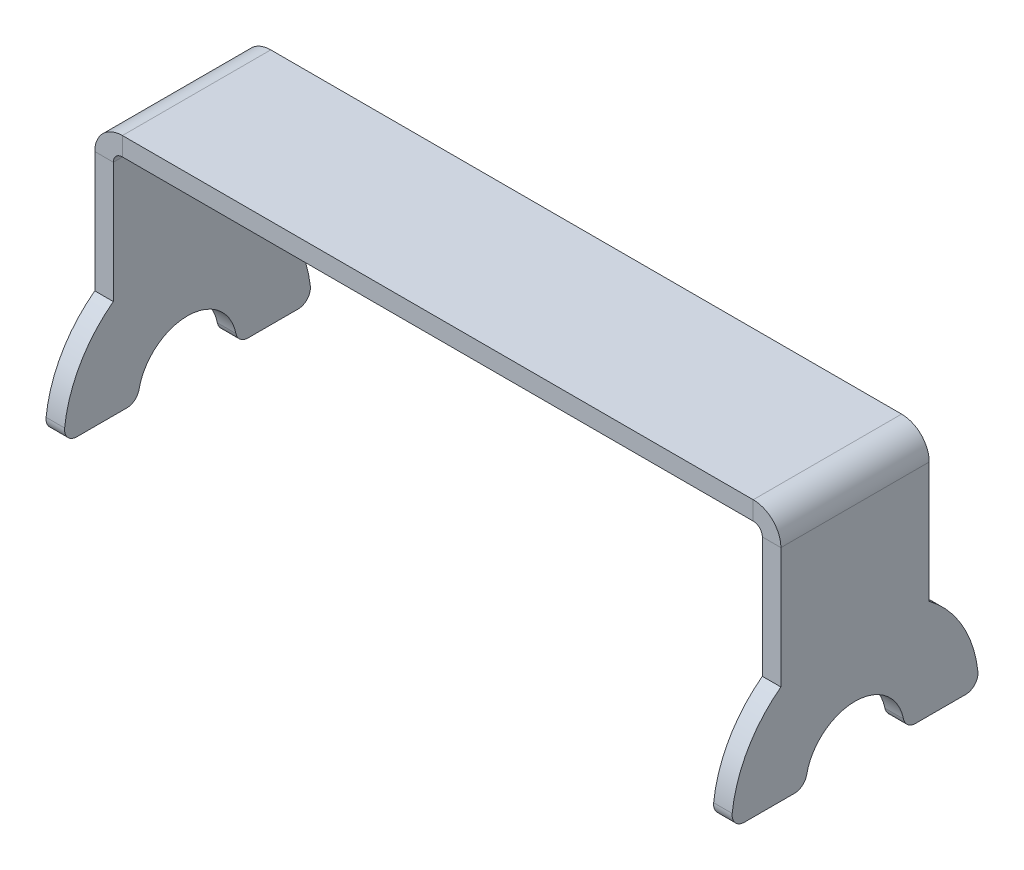
from build123d import *

# Parameters (mm, degrees)
CROQUIS2_W                         = 55.5
CROQUIS2_H                         = 12
BRIDA_BASE1_DEPTH                  = 1.5
BRIDA_DE_ARISTA1_STRIP_W           = 7.4732
BRIDA_DE_ARISTA1_STRIP_H           = 1.5
BRIDA_DE_ARISTA1_STRIP_CUT_DEPTH   = 12
BRIDA_DE_ARISTA1_STRIP_2_W         = 7.4732
BRIDA_DE_ARISTA1_STRIP_2_H         = 1.5
BRIDA_DE_ARISTA1_STRIP_CUT_2_DEPTH = 12
BRIDA_DE_ARISTA1_DEPTH             = 12
BRIDA_DE_ARISTA1_BEND_DEPTH        = 12
SALIENTE_EXTRUIR1_DEPTH            = 1.5
SALIENTE_EXTRUIR2_START            = -1.5
SALIENTE_EXTRUIR2_DEPTH            = 1.5
CORTAR_EXTRUIR2_REACH              = 61.835
CROQUIS17_R                        = 4
REDONDEO1_R                        = 1
REDONDEO2_R                        = 1


# Sheet-metal steps are written as plain solids
with BuildPart() as part:
    # Croquis2 → Brida base1 (new body)
    with BuildSketch(Plane(origin=(0, 0, 0), x_dir=(1, 0, 0), z_dir=(0, 1, 0))):
        Rectangle(CROQUIS2_W, CROQUIS2_H)
    extrude(amount=-BRIDA_BASE1_DEPTH)

    # Brida de arista1 strip (across the edge) → Brida de arista1 strip cut (cut)
    with BuildSketch(Plane(origin=(-27.75, -1.5, 6), x_dir=(1, 0, 0), z_dir=(0, 0, -1))):
        with Locations((-1.5, -0.75)):
            Rectangle(BRIDA_DE_ARISTA1_STRIP_W, BRIDA_DE_ARISTA1_STRIP_H)
    extrude(amount=BRIDA_DE_ARISTA1_STRIP_CUT_DEPTH, mode=Mode.SUBTRACT)

    # Brida de arista1 strip 2 (across the edge) → Brida de arista1 strip cut 2 (cut)
    with BuildSketch(Plane(origin=(27.75, -1.5, -6), x_dir=(-1, 0, 0), z_dir=(0, 0, 1))):
        with Locations((-1.5, -0.75)):
            Rectangle(BRIDA_DE_ARISTA1_STRIP_2_W, BRIDA_DE_ARISTA1_STRIP_2_H)
    extrude(amount=BRIDA_DE_ARISTA1_STRIP_CUT_2_DEPTH, mode=Mode.SUBTRACT)

    # Brida de arista1 section (across the edge) → Brida de arista1 (add)
    with BuildSketch(Plane(origin=(-27.75, -1.5, 6), x_dir=(1, 0, 0), z_dir=(0, 0, -1))):
        with BuildLine():
            Line((0, 0.7366), (0, 18.5))
            Line((0, 18.5), (1.5, 18.5))
            Line((1.5, 18.5), (1.5, 0.7366))
            ThreePointArc((1.5, 0.7366), (1.715745145, 0.215745145), (2.2366, 0))
            Line((2.2366, 0), (2.2366, -1.5))
            ThreePointArc((2.2366, -1.5), (0.655084973, -0.844915027), (0, 0.7366))
        make_face()
    extrude(amount=BRIDA_DE_ARISTA1_DEPTH)

    # Brida de arista1 section 2 (across the edge) → Brida de arista1 bend (add)
    with BuildSketch(Plane(origin=(27.75, -1.5, -6), x_dir=(-1, 0, 0), z_dir=(0, 0, 1))):
        with BuildLine():
            Line((0, 0.7366), (0, 18.5))
            Line((0, 18.5), (1.5, 18.5))
            Line((1.5, 18.5), (1.5, 0.7366))
            ThreePointArc((1.5, 0.7366), (1.715745145, 0.215745145), (2.2366, 0))
            Line((2.2366, 0), (2.2366, -1.5))
            ThreePointArc((2.2366, -1.5), (0.655084973, -0.844915027), (0, 0.7366))
        make_face()
    extrude(amount=BRIDA_DE_ARISTA1_BEND_DEPTH)

    # Croquis13 → Saliente-Extruir1 (add)
    with BuildSketch(Plane.ZY.offset(27.75)):
        with BuildLine():
            Line((-6, -20), (-10, -20))
            ThreePointArc((-10, -20), (-8.94427191, -15.527864045), (-6, -12))
            Line((-6, -12), (-6, -20))
        make_face()
        with BuildLine():
            Line((6, -20), (10, -20))
            ThreePointArc((10, -20), (8.94427191, -15.527864045), (6, -12))
            Line((6, -12), (6, -20))
        make_face()
    extrude(amount=-SALIENTE_EXTRUIR1_DEPTH)

    # Croquis16 → Saliente-Extruir2 (add)
    with BuildSketch(Plane(origin=(27.75, 0, 0), x_dir=(0, 0, -1), z_dir=(1, 0, 0)).offset(SALIENTE_EXTRUIR2_START)):
        with BuildLine():
            Line((-10, -20), (-6, -20))
            Line((-6, -20), (-6, -12))
            ThreePointArc((-6, -12), (-8.94427191, -15.527864045), (-10, -20))
        make_face()
        with BuildLine():
            Line((6, -20), (10, -20))
            ThreePointArc((10, -20), (8.94427191, -15.527864045), (6, -12))
            Line((6, -12), (6, -20))
        make_face()
    extrude(amount=SALIENTE_EXTRUIR2_DEPTH)

    # Cortar-Extruir2: up to this face of the body (flat: up to its plane)
    cortar_extruir2_end = Plane(part.part.faces().sort_by_distance((27.75, -12.121081048, 0))[0])
    # Croquis17 → Cortar-Extruir2 (cut, up to the picked face)
    with BuildSketch(Plane.ZY.offset(27.75), mode=Mode.PRIVATE) as cortar_extruir2_sk1:
        with Locations((0, -20)):
            Circle(CROQUIS17_R)
    cortar_extruir2_tool1 = split(extrude(cortar_extruir2_sk1.sketch, amount=-CORTAR_EXTRUIR2_REACH, mode=Mode.PRIVATE), bisect_by=cortar_extruir2_end, keep=Keep.BOTH, mode=Mode.PRIVATE)
    add(cortar_extruir2_tool1.solids().sort_by(Axis((-27.75, -20, 0), (1, 0, 0)))[0], mode=Mode.SUBTRACT)

    # Redondeo1
    redondeo1_edges = [part.edges().sort_by_distance(p)[0] for p in [
        (27, -20, -10),
        (27, -20, 10),
        (27, -20, 4),
        (27, -20, -4),
    ]]
    fillet(redondeo1_edges, radius=REDONDEO1_R)

    # Redondeo2
    redondeo2_edges = [part.edges().sort_by_distance(p)[0] for p in [
        (-27, -20, -4),
        (-27, -20, 4),
        (-27, -20, -10),
        (-27, -20, 10),
    ]]
    fillet(redondeo2_edges, radius=REDONDEO2_R)


solid = part.part
